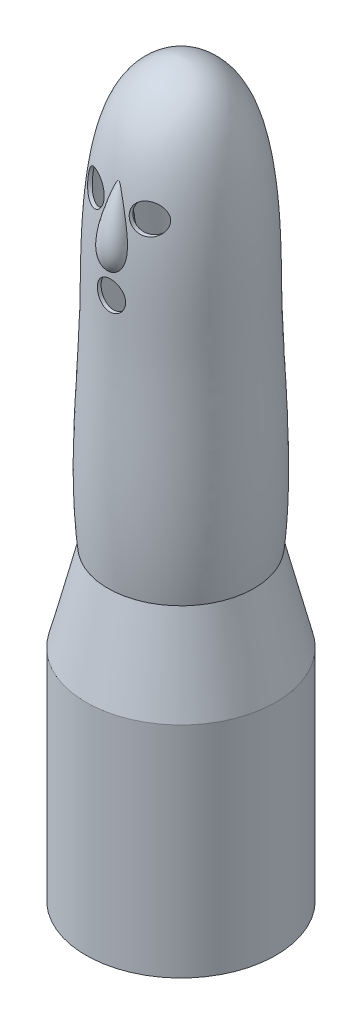
from build123d import *

# Parameters (mm, degrees)
SHELL_1_T                = -5
CUT_EXTRUDE_1_DEPTH      = 1017.759558696
CUT_EXTRUDE_1_DEPTH_BACK = 25
SKETCH_5_R               = 19.941964612
SKETCH_5_R_2             = 19.248522188
SKETCH_5_R_3             = 19.374549972


with BuildPart() as part:
    # ｽｹｯﾁ3 → 回転1 (revolve)
    with BuildSketch(Plane.XY):
        with BuildLine():
            Line((0, 0), (0, 1000))
            add(Edge.make_bspline(
                [(0, 1000), (63.34904582, 993.266837885), (98.963882813, 866.066159918), (94.768635587, 668.430558356), (109.768034461, 515.283348953), (100, 420)],
                knots=[0, 0, 0, 0, 0.273809412, 0.534020346, 1, 1, 1, 1], degree=3))
            Line((100, 420), (130, 300))
            Line((130, 300), (130, 0))
            Line((130, 0), (0, 0))
        make_face()
    revolve(axis=Axis((0, 0, 0), (0, 1, 0)))

    # ｼｪﾙ1
    shell_1_openings = [part.faces().sort_by_distance(p)[0] for p in [
        (0, 0, 0),
    ]]
    offset(amount=SHELL_1_T, openings=shell_1_openings, kind=Kind.INTERSECTION)

    # ｽｹｯﾁ5 → ｶｯﾄ - 押し出し1 (cut, two sides: drawn at the far end of the back side and taken through both)
    with BuildSketch(Plane.XY.offset(-CUT_EXTRUDE_1_DEPTH_BACK)):
        with Locations((-36.723674601, 867.204751756)):
            Circle(SKETCH_5_R)
        with Locations((36.908988744, 867.204751756)):
            Circle(SKETCH_5_R_2)
        with Locations((0, 765.703520076)):
            Circle(SKETCH_5_R_3)
    extrude(amount=CUT_EXTRUDE_1_DEPTH + CUT_EXTRUDE_1_DEPTH_BACK, mode=Mode.SUBTRACT)

    # ｽｹｯﾁ6 → 回転2 (revolve)
    with BuildSketch(Plane(origin=(0, 0, 0), x_dir=(0, 0, -1), z_dir=(1, 0, 0))):
        with BuildLine():
            Line((-93.331972925, 791.569316378), (-78.729758395, 912.34568148))
            add(Edge.make_bspline(
                [(-93.331972925, 791.569316378), (-131.373194629, 811.424734282), (-88.773863032, 882.956685318), (-78.729758395, 912.34568148)],
                knots=[0, 0, 0, 0, 1, 1, 1, 1], degree=3))
        make_face()
    revolve(axis=Axis((0, 791.569316378, 93.331972925), (0, 0.9927704058225354, -0.12002883538116348)))


solid = part.part
